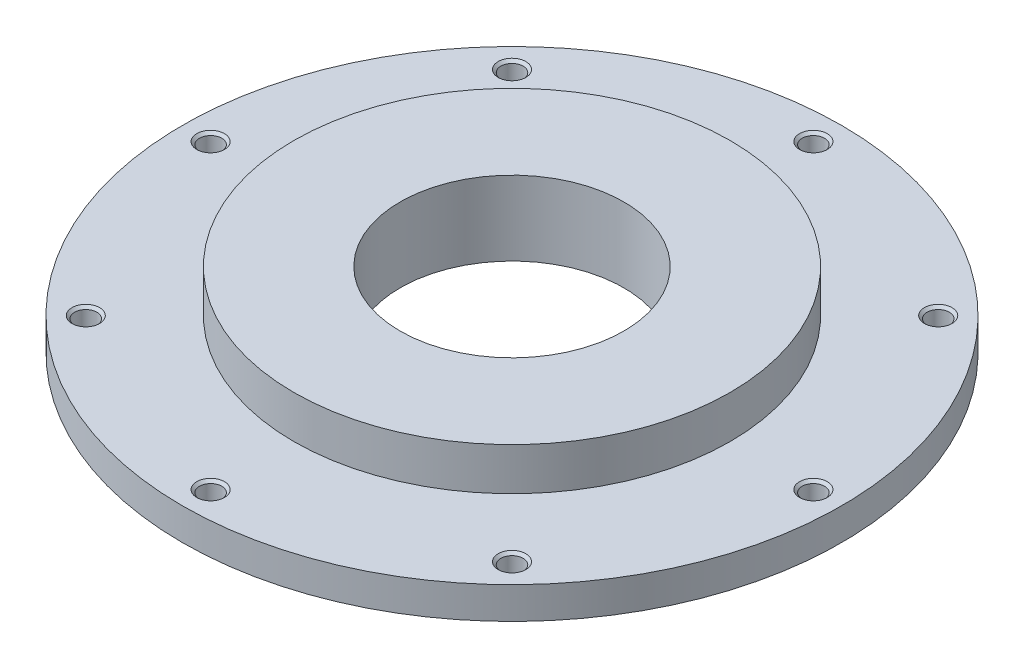
from build123d import *

# Parameters (mm, degrees)
SKETCH1_R                    = 62
SKETCH1_R_2                  = 21.05
BOSS_EXTRUDE1_DEPTH          = 6
SKETCH2_R                    = 41.05
SKETCH2_R_2                  = 21.05
BOSS_EXTRUDE2_DEPTH          = 8
SKETCH3_R                    = 2.1
CUT_EXTRUDE1_DEPTH           = 8
CHAMFER1_SIZE                = 0.5
CIRPATTERN1_COUNT            = 8
CHAMFER1_OF_CIRPATTERN1_SIZE = 0.5


with BuildPart() as part:
    # Sketch1 → Boss-Extrude1 (new body)
    with BuildSketch(Plane(origin=(0, 0, 0), x_dir=(1, 0, 0), z_dir=(0, 1, 0))):
        Circle(SKETCH1_R)
        Circle(SKETCH1_R_2, mode=Mode.SUBTRACT)
    extrude(amount=BOSS_EXTRUDE1_DEPTH)

    # Sketch2 → Boss-Extrude2 (add)
    with BuildSketch(Plane(origin=(0, 6, 0), x_dir=(1, 0, 0), z_dir=(0, 1, 0))):
        Circle(SKETCH2_R)
        Circle(SKETCH2_R_2, mode=Mode.SUBTRACT)
    extrude(amount=BOSS_EXTRUDE2_DEPTH)

    # Sketch3 → Cut-Extrude1 (cut)
    with BuildSketch(Plane(origin=(0, 6, 0), x_dir=(1, 0, 0), z_dir=(0, 1, 0))):
        with Locations((-56.7, 0)):
            Circle(SKETCH3_R)
    cut_extrude1 = extrude(amount=-CUT_EXTRUDE1_DEPTH, mode=Mode.SUBTRACT)

    # Chamfer1
    chamfer1_edges = [part.edges().sort_by_distance(p)[0] for p in [
        (-58.8, 6, 0),
    ]]
    chamfer(chamfer1_edges, length=CHAMFER1_SIZE)

    # CirPattern1: Cut-Extrude1 ×8 about axis
    cirpattern1_axis = Axis((0, 6, 0), (0, 1, 0))
    for i in range(1, CIRPATTERN1_COUNT):
        add(cut_extrude1.rotate(cirpattern1_axis, i * 360 / CIRPATTERN1_COUNT), mode=Mode.SUBTRACT)

    # Chamfer1 of CirPattern1
    chamfer1_of_cirpattern1_edges = [part.edges().sort_by_distance(p)[0] for p in [
        (-41.577878734, 6, 41.577878734),
        (0, 6, 58.8),
        (41.577878734, 6, 41.577878734),
        (58.8, 6, 0),
        (41.577878734, 6, -41.577878734),
        (0, 6, -58.8),
        (-41.577878734, 6, -41.577878734),
    ]]
    chamfer(chamfer1_of_cirpattern1_edges, length=CHAMFER1_OF_CIRPATTERN1_SIZE)


solid = part.part
